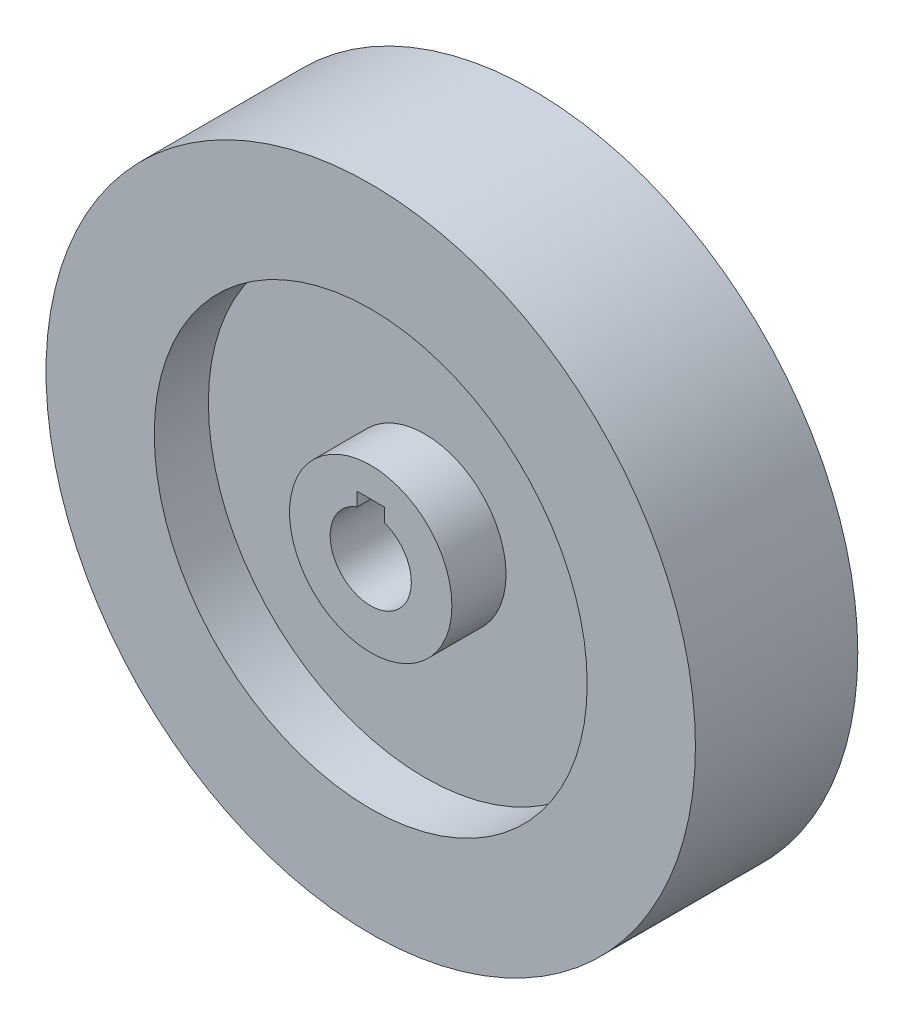
from build123d import *

# Parameters (mm, degrees)
SKETCH4_W          = 6.35
SKETCH4_H          = 3.175
CUT_EXTRUDE1_DEPTH = 115.3


with BuildPart() as part:
    # Sketch1 → Revolve1 (revolve)
    with BuildSketch(Plane(origin=(0, 0, 0), x_dir=(0, 0, -1), z_dir=(1, 0, 0))):
        Polygon((19.05, 9.525), (-19.05, 9.525), (-19.05, 19.05), (-6.35, 19.05), (-6.35, 50.8), (-19.05, 50.8), (-19.05, 76.2), (19.05, 76.2), (19.05, 50.8), (6.35, 50.8), (6.35, 19.05), (19.05, 19.05), align=None)
    revolve(axis=Axis((0, 0, 34.214514903), (0, 0, -1)))

    # Sketch4 → Cut-Extrude1 (cut, through all)
    with BuildSketch(Plane(origin=(0, 0, -19.05), x_dir=(-1, 0, 0), z_dir=(0, 0, -1))):
        with Locations((0, 10.567756121)):
            Rectangle(SKETCH4_W, SKETCH4_H)
    extrude(amount=-CUT_EXTRUDE1_DEPTH, mode=Mode.SUBTRACT)


solid = part.part
